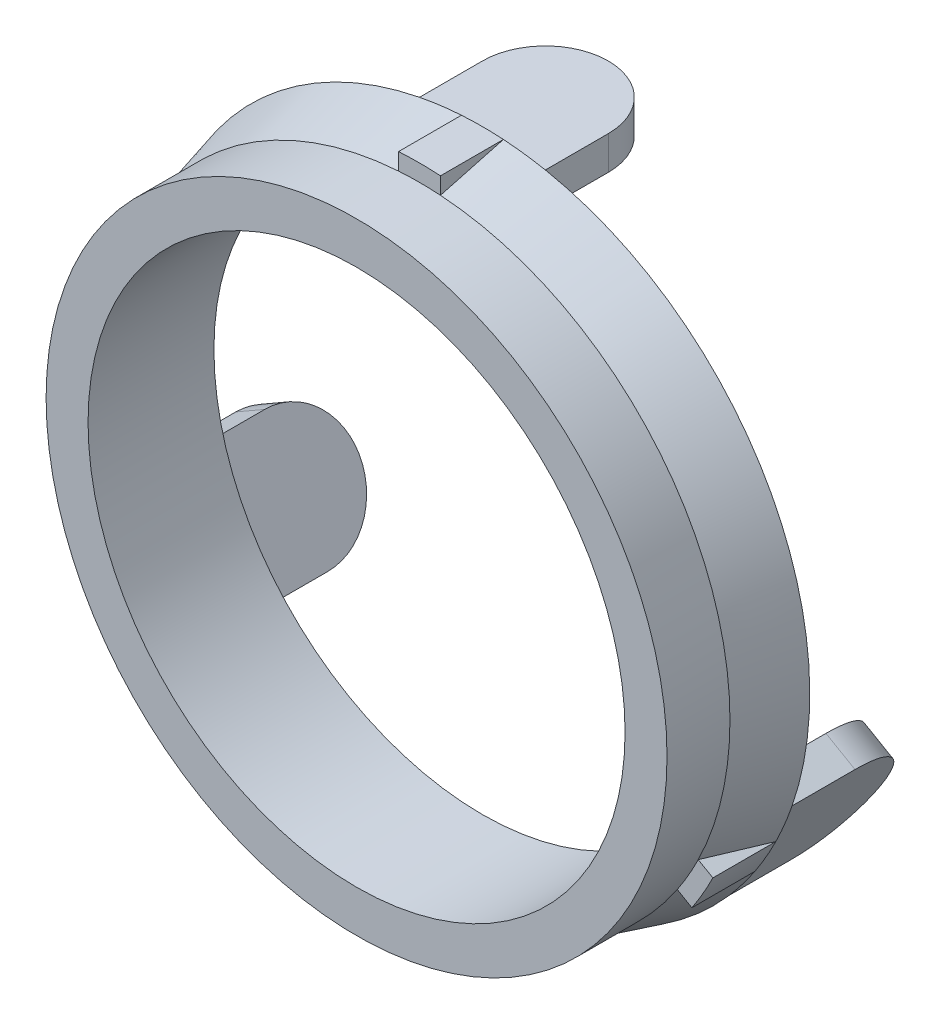
from build123d import *

# Parameters (mm, degrees)
BOSS_EXTRUDE1_DEPTH      = 7.5
SKETCH6_W                = 15
SKETCH6_H                = 4
BOSS_EXTRUDE2_DEPTH      = 15
FILLET1_R                = 7.5
CIRPATTERN1_COUNT        = 3
FILLET1_OF_CIRPATTERN1_R = 7.5


with BuildPart() as part:
    # Sketch2 → Revolve1 (revolve)
    with BuildSketch(Plane(origin=(0, 0, 0), x_dir=(1, 0, 0), z_dir=(0, 1, 0))):
        Polygon((37, 0), (37, -7.5), (32, -7.5), (32, 7.5), (39.009618943, 7.5), align=None)
    revolve(axis=Axis((0, 0, 7.5), (0, 0, -1)))

    # Sketch3 → Boss-Extrude1 (add)
    with BuildSketch(Plane(origin=(0, 0, -7.5), x_dir=(-1, 0, 0), z_dir=(0, 0, -1))):
        with BuildLine():
            Line((-2.5, 38.929428073), (-2.5, 33.929428073))
            Line((-2.5, 33.929428073), (2.5, 33.929428073))
            Line((2.5, 33.929428073), (2.5, 38.929428073))
            ThreePointArc((2.5, 38.929428073), (0, 39.009618943), (-2.5, 38.929428073))
        make_face()
    boss_extrude1 = extrude(amount=-BOSS_EXTRUDE1_DEPTH)

    # Sketch6 → Boss-Extrude2 (add)
    with BuildSketch(Plane(origin=(0, 0, -7.5), x_dir=(-1, 0, 0), z_dir=(0, 0, -1))):
        with Locations((0, 36.281854319)):
            Rectangle(SKETCH6_W, SKETCH6_H)
    boss_extrude2 = extrude(amount=BOSS_EXTRUDE2_DEPTH)

    # Fillet1
    fillet1_edges = [part.edges().sort_by_distance(p)[0] for p in [
        (-7.5, 36.281854319, -22.5),
        (7.5, 36.281854319, -22.5),
    ]]
    fillet(fillet1_edges, radius=FILLET1_R - 0.0001)  # a hair under: the kernel refuses the full size

    # CirPattern1: Boss-Extrude1, Boss-Extrude2 ×3 about axis
    cirpattern1_axis = Axis((0, 0, 0), (0, 0, 1))
    add([boss_extrude1.rotate(cirpattern1_axis, i * 360 / CIRPATTERN1_COUNT) for i in range(1, CIRPATTERN1_COUNT)])
    add([boss_extrude2.rotate(cirpattern1_axis, i * 360 / CIRPATTERN1_COUNT) for i in range(1, CIRPATTERN1_COUNT)])

    # Fillet1 of CirPattern1
    fillet1_of_cirpattern1_edges = [part.edges().sort_by_distance(p)[0] for p in [
        (-27.671007537, -24.636117688, -22.5),
        (-35.171007537, -11.645736631, -22.5),
        (35.171007537, -11.645736631, -22.5),
        (27.671007537, -24.636117688, -22.5),
    ]]
    fillet(fillet1_of_cirpattern1_edges, radius=FILLET1_OF_CIRPATTERN1_R - 0.0001)  # a hair under: the kernel refuses the full size


solid = part.part
